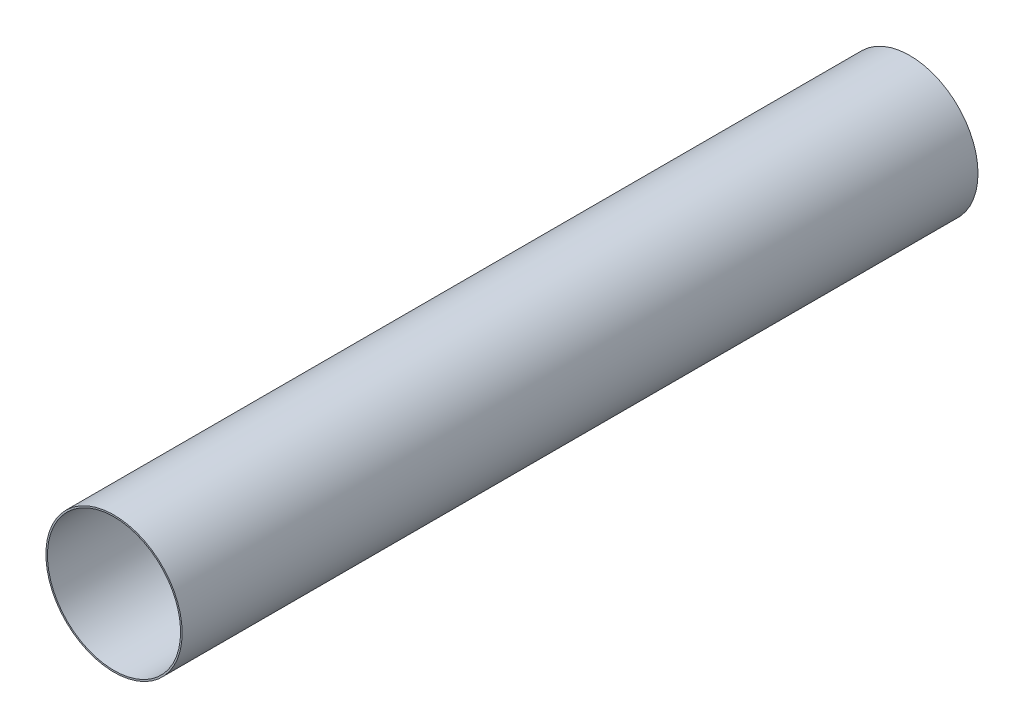
from build123d import *

# Parameters (mm, degrees)
SKETCH1_R           = 86.99983
SKETCH1_R_2         = 84.99983
BOSS_EXTRUDE1_DEPTH = 508


with BuildPart() as part:
    # Sketch1 → Boss-Extrude1 (new, symmetric)
    with BuildSketch(Plane.XY):
        Circle(SKETCH1_R)
        Circle(SKETCH1_R_2, mode=Mode.SUBTRACT)
    extrude(amount=BOSS_EXTRUDE1_DEPTH, both=True)


solid = part.part
